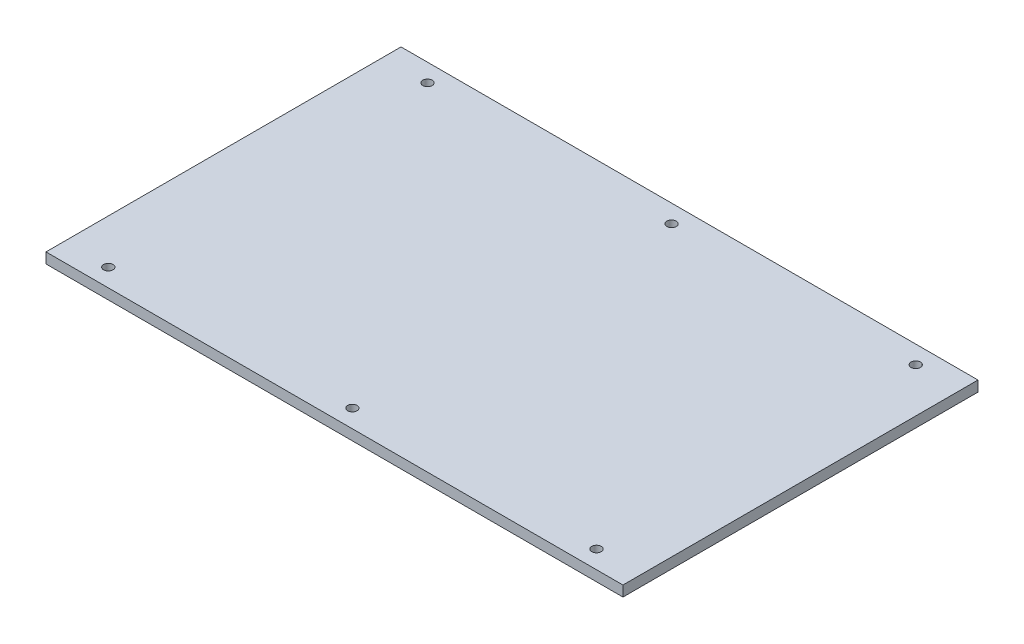
from build123d import *

# Parameters (mm, degrees)
BASE_FLANGE1_OUTLINE_W = 165.1
BASE_FLANGE1_OUTLINE_H = 3
BASE_FLANGE1_DEPTH     = 101.6
SKETCH2_R              = 1.3462
CUT_EXTRUDE1_DEPTH     = 194.880298122


# Read off the part's stored shape, not the designer's step: Base-Flange1
with BuildPart() as part:
    # Base-Flange1 outline → Base-Flange1 (new body)
    with BuildSketch(Plane.XY):
        with Locations((82.55, 1.5)):
            Rectangle(BASE_FLANGE1_OUTLINE_W, BASE_FLANGE1_OUTLINE_H)
    extrude(amount=BASE_FLANGE1_DEPTH)

    # Sketch2 → Cut-Extrude1 (cut, through all)
    with BuildSketch(Plane(origin=(0, 3, 0), x_dir=(1, 0, 0), z_dir=(0, 1, 0))):
        with Locations(Location((152.4, -5.1308, 0), (0, 0, 270))):
            Circle(SKETCH2_R)
        with Locations(Location((152.4, -96.4692, 0), (0, 0, 270))):
            Circle(SKETCH2_R)
        with Locations(Location((82.55, -96.4692, 0), (0, 0, 270))):
            Circle(SKETCH2_R)
        with Locations(Location((12.7, -96.4692, 0), (0, 0, 270))):
            Circle(SKETCH2_R)
        with Locations(Location((12.7, -5.1308, 0), (0, 0, 270))):
            Circle(SKETCH2_R)
        with Locations(Location((82.55, -5.1308, 0), (0, 0, 270))):
            Circle(SKETCH2_R)
    extrude(amount=-CUT_EXTRUDE1_DEPTH, mode=Mode.SUBTRACT)


solid = part.part
